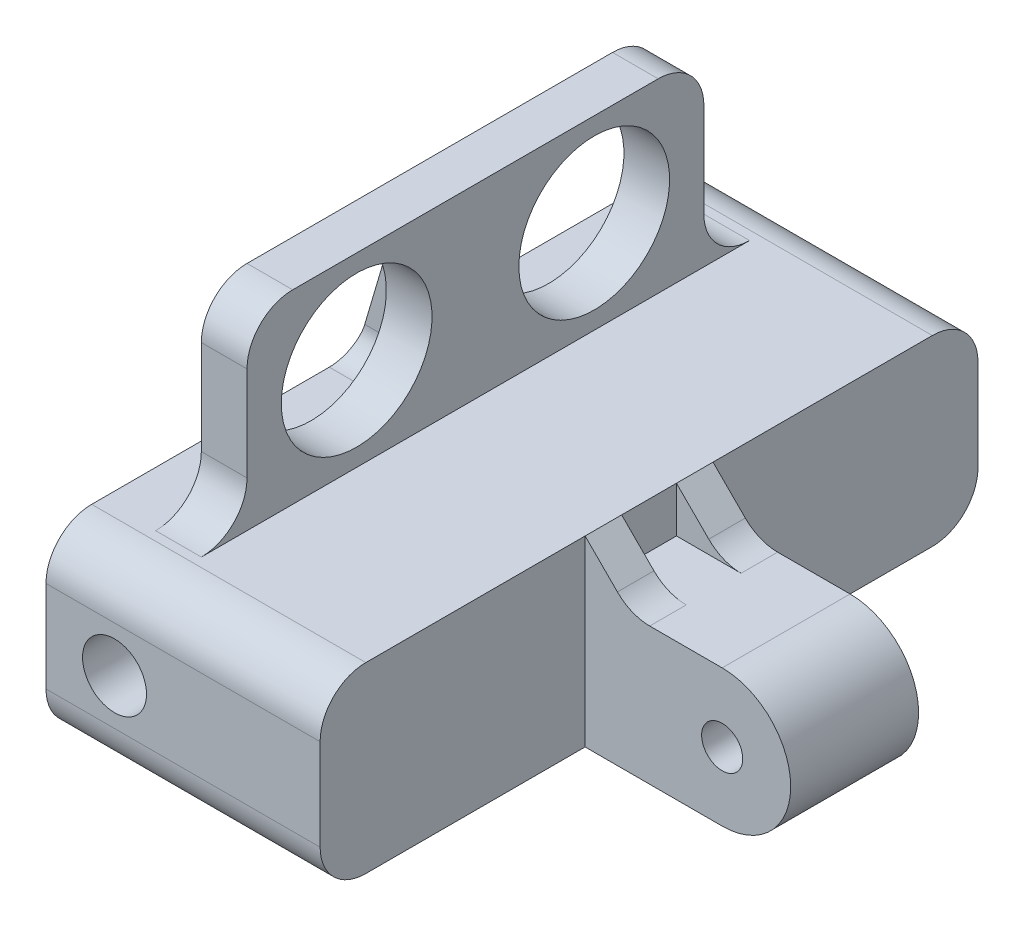
from build123d import *

# Parameters (mm, degrees)
SKETCH1_R               = 2.2500000000000004
BOSS_EXTRUDE1_DEPTH     = 14
BOSS_EXTRUDE2_DEPTH     = 30
SKETCH3_R               = 7
CUT_EXTRUDE1_DEPTH      = 15
FILLET1_R               = 5
RIB1_REACH              = 65.484
SKETCH4_WALL_W          = 136.0395678423848
SKETCH4_WALL_H          = 4
FILLET2_R               = 5
BOSS_EXTRUDE3_START     = -6
SKETCH6_W               = 50
SKETCH6_H               = 20.33166445293904
BOSS_EXTRUDE3_DEPTH     = 5
CUT_EXTRUDE2_REACH      = 73.338
SKETCH7_R               = 8.250000000000005
SKETCH7_R_2             = 8.25
FILLET3_R               = 5
FILLET4_R               = 5
RIB2_REACH              = 68.324
SKETCH8_WALL_W          = 155.84718590256796
SKETCH8_WALL_H          = 4
FILLET5_R               = 3
CUT_EXTRUDE3_DEPTH      = 20
FILLET6_R               = 2
CUT_EXTRUDE4_REACH      = 93.033
CUT_EXTRUDE4_END_RADIUS = 7
SKETCH10_R              = 3.5000000000000004


with BuildPart() as part:
    # Sketch1 → Boss-Extrude1 (new body)
    with BuildSketch(Plane.XY):
        with BuildLine():
            Line((9.2e-16, 7.5), (-14.999999999999998, 7.500000000000002))
            Line((-14.999999999999998, 7.500000000000002), (-14.999999999999998, -7.500000000000002))
            Line((-14.999999999999998, -7.500000000000002), (9.2e-16, -7.5))
            ThreePointArc((9.2e-16, -7.5), (7.5, 0), (9.2e-16, 7.5))
        make_face()
        Circle(SKETCH1_R, mode=Mode.SUBTRACT)
    extrude(amount=BOSS_EXTRUDE1_DEPTH)

    # Sketch2 → Boss-Extrude2 (add)
    with BuildSketch(Plane.ZY.offset(14.999999999999998)):
        Polygon((-28.999999999999993, -7.500000000000002), (43, -7.500000000000002), (42.99999999999999, 12.499999999999998), (-28.99999999999999, 12.499999999999998), align=None)
    extrude(amount=BOSS_EXTRUDE2_DEPTH)

    # Sketch3 → Cut-Extrude1 (cut)
    with BuildSketch(Plane.ZY.offset(45)):
        with Locations((28.999999999999996, 2.499999999999998)):
            Circle(SKETCH3_R)
        with Locations((-15, 2.499999999999998)):
            Circle(SKETCH3_R)
    extrude(amount=-CUT_EXTRUDE1_DEPTH, mode=Mode.SUBTRACT)

    # Fillet1
    fillet1_edges = [part.edges().sort_by_distance(p)[0] for p in [
        (-30, 12.499999999999998, -28.99999999999999),
        (-30, -7.500000000000002, -28.999999999999993),
        (-30, -7.500000000000002, 43),
        (-30, 12.499999999999998, 42.99999999999999),
    ]]
    fillet(fillet1_edges, radius=FILLET1_R)

    # Sketch4 wall → Rib1 (add, up to next)
    with BuildSketch(Plane(origin=(-12.5, 10, 14), x_dir=(0.707106781187, -0.707106781187, 0), z_dir=(0.707106781187, 0.707106781187, 0)), mode=Mode.PRIVATE) as rib1_sk1:
        with Locations((0, 2)):
            Rectangle(SKETCH4_WALL_W, SKETCH4_WALL_H)
    rib1_tool1 = extrude(rib1_sk1.sketch, amount=-RIB1_REACH, mode=Mode.PRIVATE) - part.part
    rib1 = rib1_tool1.solids().sort_by_distance((-12.5, 10, 14))[0]
    add(rib1)

    # Mirror1: Rib1 across plane
    add(rib1.mirror(Plane.XY.offset(7)))

    # Fillet2
    fillet2_edges = [part.edges().sort_by_distance(p)[0] for p in [
        (-10.000000000000002, 7.500000000000001, 2),
        (-10.000000000000002, 7.500000000000001, 12),
    ]]
    fillet(fillet2_edges, radius=FILLET2_R)

    # Sketch6 → Boss-Extrude3 (add)
    with BuildSketch(Plane.ZY.offset(45).offset(BOSS_EXTRUDE3_START)):
        with Locations((7.000000000000005, 22.665832226469526)):
            Rectangle(SKETCH6_W, SKETCH6_H)
    extrude(amount=-BOSS_EXTRUDE3_DEPTH)

    # Sketch7 → Cut-Extrude2 (cut, up to next)
    with BuildSketch(Plane.ZY.offset(39), mode=Mode.PRIVATE) as cut_extrude2_sk1:
        with Locations((-5.999999999999993, 22.665832226469526)):
            Circle(SKETCH7_R)
    cut_extrude2_tool1 = extrude(cut_extrude2_sk1.sketch, amount=-CUT_EXTRUDE2_REACH, mode=Mode.PRIVATE) & part.part
    # Sketch7 → Cut-Extrude2 (cut, up to next)
    with BuildSketch(Plane.ZY.offset(39), mode=Mode.PRIVATE) as cut_extrude2_sk2:
        with Locations((20.000000000000007, 22.665832226469526)):
            Circle(SKETCH7_R_2)
    cut_extrude2_tool2 = extrude(cut_extrude2_sk2.sketch, amount=-CUT_EXTRUDE2_REACH, mode=Mode.PRIVATE) & part.part
    add(cut_extrude2_tool1.solids().sort_by_distance((-39, 22.665832, -6))[0], mode=Mode.SUBTRACT)
    add(cut_extrude2_tool2.solids().sort_by_distance((-39, 22.665832, 20))[0], mode=Mode.SUBTRACT)

    # Fillet3
    fillet3_edges = [part.edges().sort_by_distance(p)[0] for p in [
        (-36.5, 12.500000000000004, -17.999999999999996),
        (-36.5, 12.500000000000004, 32.00000000000001),
    ]]
    fillet(fillet3_edges, radius=FILLET3_R)

    # Fillet4
    fillet4_edges = [part.edges().sort_by_distance(p)[0] for p in [
        (-36.5, 32.831664452939044, -17.999999999999996),
        (-36.5, 32.831664452939044, 32.00000000000001),
    ]]
    fillet(fillet4_edges, radius=FILLET4_R)

    # Sketch8 wall → Rib2 (add, up to next)
    with BuildSketch(Plane(origin=(-42, 22.665832227, 7), x_dir=(-0.283038838463, -0.959108448467, 0), z_dir=(0.959108448467, -0.283038838463, 0)), mode=Mode.PRIVATE) as rib2_sk1:
        Rectangle(SKETCH8_WALL_W, SKETCH8_WALL_H)
    rib2_tool1 = extrude(rib2_sk1.sketch, amount=RIB2_REACH, mode=Mode.PRIVATE) - part.part
    add(rib2_tool1.solids().sort_by_distance((-42, 22.665832227, 7))[0])

    # Fillet5
    fillet5_edges = [part.edges().sort_by_distance(p)[0] for p in [
        (-42, 12.5, 9),
        (-42, 12.5, 5),
    ]]
    fillet(fillet5_edges, radius=FILLET5_R)

    # Sketch9 → Cut-Extrude3 (cut)
    with BuildSketch(Plane.ZY.offset(45)):
        with BuildLine():
            Line((-10.499999999999998, 10.499999999999998), (24.500000000000004, 10.499999999999998))
            ThreePointArc((24.500000000000004, 10.499999999999998), (16.500000000000004, 2.4999999999999996), (24.500000000000004, -5.500000000000002))
            Line((24.500000000000004, -5.500000000000002), (-10.499999999999998, -5.500000000000002))
            ThreePointArc((-10.499999999999998, -5.500000000000002), (-2.4999999999999982, 2.4999999999999987), (-10.499999999999998, 10.499999999999998))
        make_face()
    extrude(amount=-CUT_EXTRUDE3_DEPTH, mode=Mode.SUBTRACT)

    # Fillet6
    fillet6_edges = [part.edges().sort_by_distance(p)[0] for p in [
        (-35, -5.500000000000002, -10.499999999999998),
        (-35, 10.5, -10.499999999999996),
        (-35, 10.499999999999998, 24.500000000000004),
        (-35, -5.500000000000002, 24.500000000000004),
    ]]
    fillet(fillet6_edges, radius=FILLET6_R - 0.0001)  # a hair under: the kernel refuses the full size

    # Cut-Extrude4: up to this cylinder (the profile starts outside it)
    cut_extrude4_end = Plane(origin=(-37.5, 2.499999999999998, -15), z_dir=(-1, 0, 0)) * Cylinder(CUT_EXTRUDE4_END_RADIUS, 201.066, mode=Mode.PRIVATE)
    # Sketch10 → Cut-Extrude4 (cut, up to the surface)
    with BuildSketch(Plane(origin=(0, 5.03e-15, -28.999999999999993), x_dir=(-1, 0, 0), z_dir=(0, 1.7e-16, -1)), mode=Mode.PRIVATE) as cut_extrude4_sk1:
        with Locations(Location((37.5, 2.499999999999993, 0), (0, 0, 90))):
            Circle(SKETCH10_R)
    cut_extrude4_tool1 = extrude(cut_extrude4_sk1.sketch, amount=-CUT_EXTRUDE4_REACH, mode=Mode.PRIVATE) - cut_extrude4_end
    cut_extrude4 = cut_extrude4_tool1.solids().sort_by_distance((-37.5, 2.5, -29))[0]
    add(cut_extrude4, mode=Mode.SUBTRACT)

    # Mirror2: Cut-Extrude4 across plane
    add(cut_extrude4.mirror(Plane.XY.offset(7)), mode=Mode.SUBTRACT)


solid = part.part
